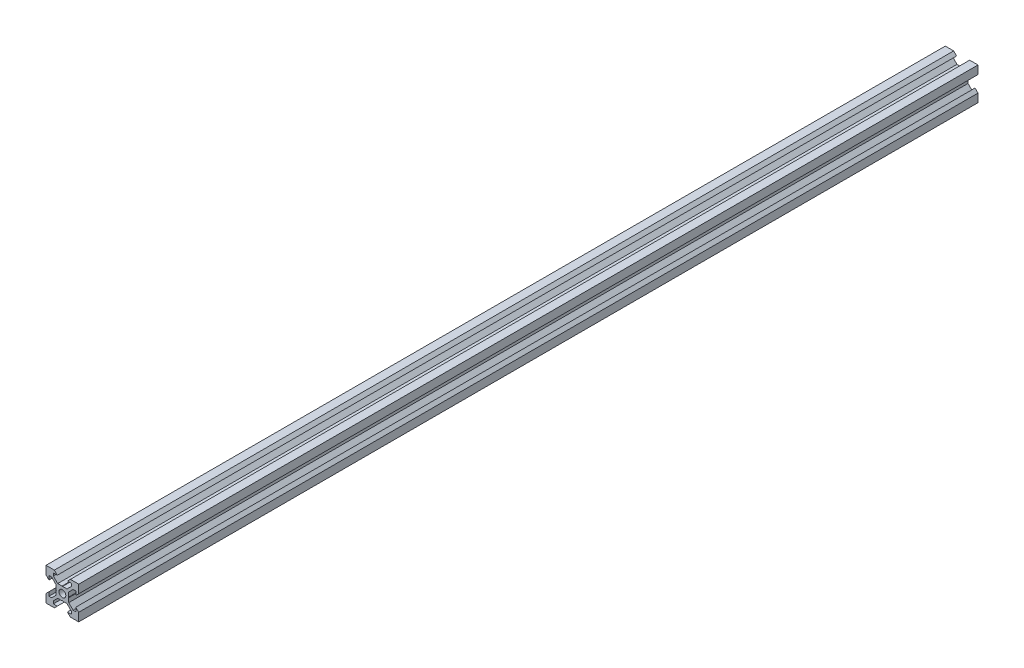
from build123d import *

# Parameters (mm, degrees)
SKETCH1_R           = 2.1
BOSS_EXTRUDE1_DEPTH = 550
CUT_EXTRUDE1_DEPTH  = 550


# Read off the part's stored shape, not the designer's step: Cut-Extrude1
with BuildPart() as part:
    # Sketch1 → Boss-Extrude1 (new body)
    with BuildSketch(Plane.XY):
        Polygon((-10, -4.9), (-10, -10), (-4.9, -10), (-3.1, -8.2), (-5.499339828, -8.2), (-5.499339828, -6.56), (-2.84, -3.900660172), (2.84, -3.900660172), (5.499339828, -6.56), (5.499339828, -8.2), (3.1, -8.2), (4.9, -10), (10, -10), (10, -4.9), (8.2, -3.1), (8.2, -5.499339828), (6.56, -5.499339828), (3.900660172, -2.84), (3.900660172, 2.84), (6.56, 5.499339828), (8.2, 5.499339828), (8.2, 3.1), (10, 4.9), (10, 10), (4.9, 10), (3.1, 8.2), (5.499339828, 8.2), (5.499339828, 6.56), (2.84, 3.900660172), (-2.84, 3.900660172), (-5.499339828, 6.56), (-5.499339828, 8.2), (-3.1, 8.2), (-4.9, 10), (-10, 10), (-10, 4.9), (-8.2, 3.1), (-8.2, 5.499339828), (-6.56, 5.499339828), (-3.900660172, 2.84), (-3.900660172, -2.84), (-6.56, -5.499339828), (-8.2, -5.499339828), (-8.2, -3.1), align=None)
        Circle(SKETCH1_R, mode=Mode.SUBTRACT)
    extrude(amount=BOSS_EXTRUDE1_DEPTH)

    # Cut-Extrude1 outline → Cut-Extrude1 (cut)
    with BuildSketch(Plane.XY):
        with BuildLine():
            ThreePointArc((-3.900660172, -0.2), (-3.700660172, 0), (-3.900660172, 0.2))
            Line((-3.900660172, 0.2), (-3.900660172, -0.2))
        make_face()
        with BuildLine():
            ThreePointArc((-0.2, 3.900660172), (0, 3.700660172), (0.2, 3.900660172))
            Line((0.2, 3.900660172), (-0.2, 3.900660172))
        make_face()
        with BuildLine():
            ThreePointArc((3.900660172, 0.2), (3.700660172, 0), (3.900660172, -0.2))
            Line((3.900660172, -0.2), (3.900660172, 0.2))
        make_face()
        with BuildLine():
            ThreePointArc((0.2, -3.900660172), (0, -3.700660172), (-0.2, -3.900660172))
            Line((-0.2, -3.900660172), (0.2, -3.900660172))
        make_face()
    extrude(amount=CUT_EXTRUDE1_DEPTH, mode=Mode.SUBTRACT)


solid = part.part
